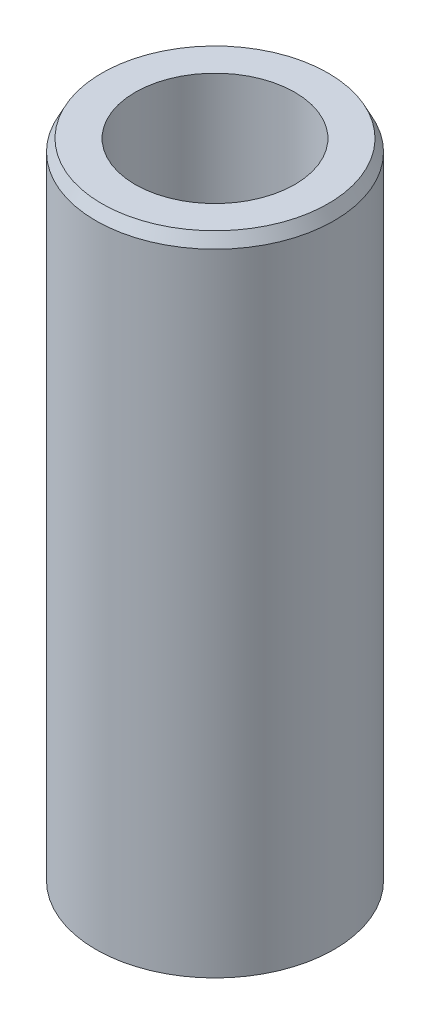
from build123d import *
from OCP.BRepFilletAPI import BRepFilletAPI_MakeChamfer

# Parameters (mm, degrees)
SKETCH1_R           = 57.5
BOSS_EXTRUDE1_DEPTH = 313.081789055
SKETCH2_R           = 38.542439088
CUT_EXTRUDE1_DEPTH  = 324.469792466
CHAMFER1_SIZE       = 5.670340424
CHAMFER1_SIZE2      = 2.892675031


with BuildPart() as part:
    # Sketch1 → Boss-Extrude1 (new body)
    with BuildSketch(Plane(origin=(0, 0, 0), x_dir=(1, 0, 0), z_dir=(0, 1, 0))):
        Circle(SKETCH1_R)
    extrude(amount=BOSS_EXTRUDE1_DEPTH)

    # Sketch2 → Cut-Extrude1 (cut, through all)
    with BuildSketch(Plane(origin=(0, 0, 0), x_dir=(1, 0, 0), z_dir=(0, 1, 0))):
        Circle(SKETCH2_R)
    extrude(amount=CUT_EXTRUDE1_DEPTH, mode=Mode.SUBTRACT)

    # Chamfer1: one chamfer whose edges measure the first distance from different faces: ONE call of the kernel's chamfer builder (chamfer() names one face for all edges)
    chamfer1_edges_1 = [part.edges().sort_by_distance(p)[0] for p in [
        (-57.5, 313.081789055, 0),
    ]]
    chamfer1_side_1 = [part.faces().sort_by_distance(p)[0] for p in [
        (-57.5, 156.540894528, 0),
    ]]
    chamfer1_edges_2 = [part.edges().sort_by_distance(p)[0] for p in [
        (-57.5, 0, 0),
    ]]
    chamfer1_side_2 = [part.faces().sort_by_distance(p)[0] for p in [
        (-55.873654403, 0, 0),
    ]]
    chamfer1 = BRepFilletAPI_MakeChamfer(part.part.solid().wrapped)
    for e in chamfer1_edges_1:
        chamfer1.Add(CHAMFER1_SIZE, CHAMFER1_SIZE2, e.wrapped, chamfer1_side_1[0].wrapped)  # the first distance lies on this face
    for e in chamfer1_edges_2:
        chamfer1.Add(CHAMFER1_SIZE, CHAMFER1_SIZE2, e.wrapped, chamfer1_side_2[0].wrapped)  # the first distance lies on this face
    add(Compound.cast(chamfer1.Shape()), mode=Mode.REPLACE)


solid = part.part
